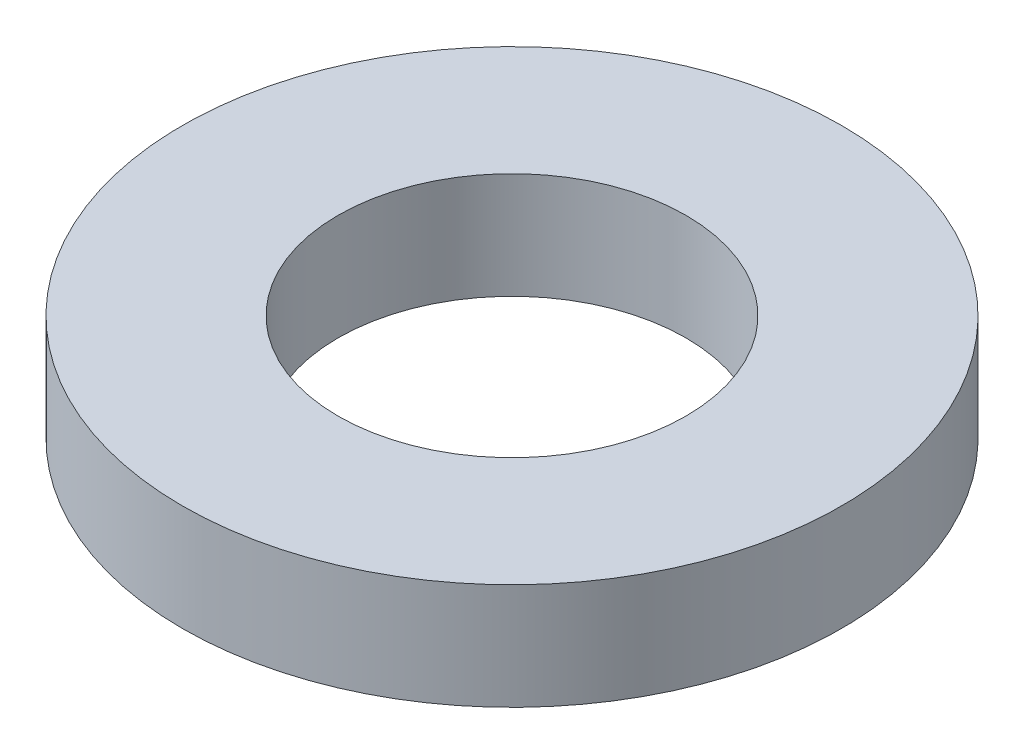
from build123d import *

# Parameters (mm, degrees)
SKETCH1_R           = 90
BOSS_EXTRUDE1_DEPTH = 29
SKETCH2_R           = 47.5
CUT_EXTRUDE1_DEPTH  = 131.541181242


with BuildPart() as part:
    # Sketch1 → Boss-Extrude1 (new body)
    with BuildSketch(Plane(origin=(0, 0, 0), x_dir=(1, 0, 0), z_dir=(0, 1, 0))):
        Circle(SKETCH1_R)
    extrude(amount=BOSS_EXTRUDE1_DEPTH)

    # Sketch2 → Cut-Extrude1 (cut, through all)
    with BuildSketch(Plane(origin=(0, 0, 0), x_dir=(1, 0, 0), z_dir=(0, 1, 0))):
        Circle(SKETCH2_R)
    extrude(amount=CUT_EXTRUDE1_DEPTH, mode=Mode.SUBTRACT)


solid = part.part
